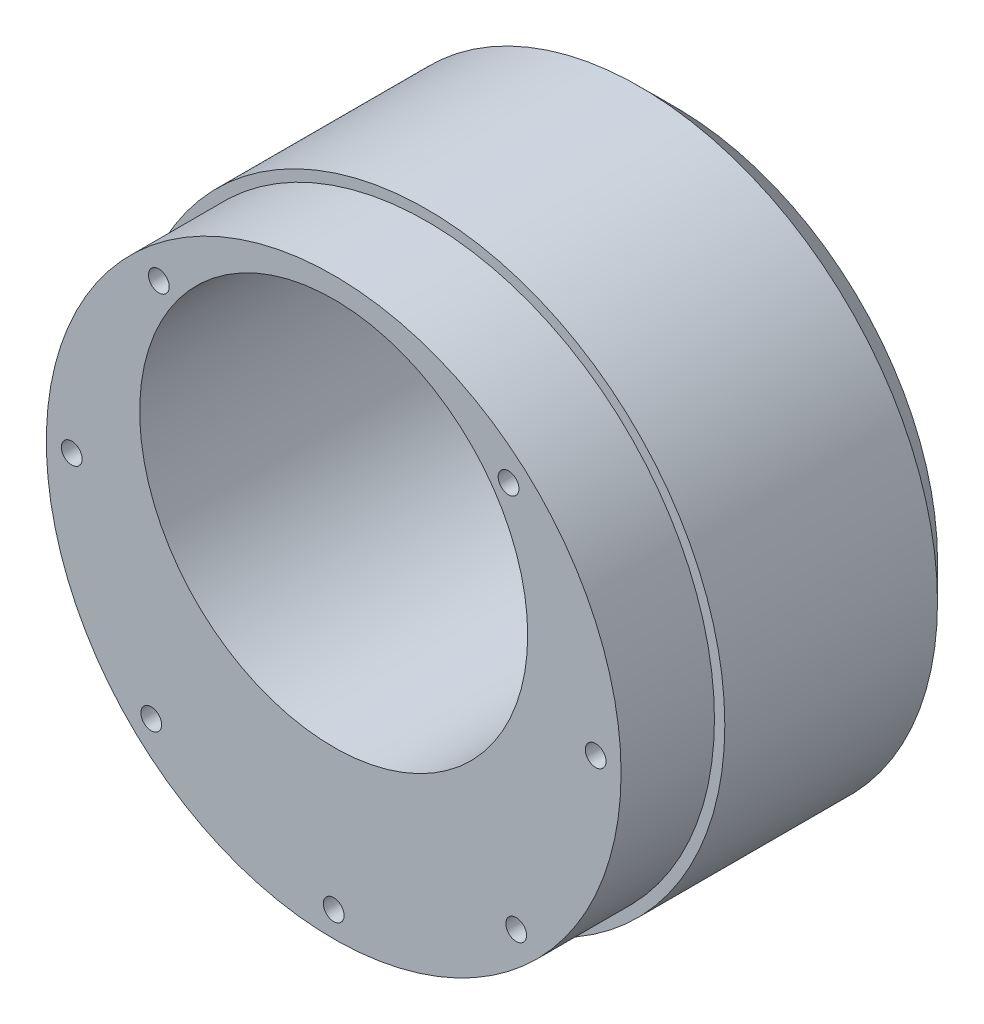
from build123d import *

# Parameters (mm, degrees)
SKETCH1_R              = 28.7
SKETCH1_R_2            = 6.15
SKETCH1_R_3            = 1.65
EXTRUDE_506_DEPTH      = 33
SKETCH2_R              = 18.7
CUT_EXTRUDE_685_DEPTH  = 27
CUT_EXTRUDE_START      = -9
SKETCH4_R              = 28.7
SKETCH4_R_2            = 27.7
CUT_EXTRUDE_817_DEPTH  = 9
SKETCH5_R              = 1
CUT_EXTRUDE_1184_DEPTH = 10
CHAMFER1_SIZE          = 3.5
SKETCH_1_R             = 3
CUT_EXTRUDE_1538_DEPTH = 2
CHAMFER_1590_SIZE      = 1.5


with BuildPart() as part:
    # Sketch1 → Extrude 506 (new body)
    with BuildSketch(Plane.XY):
        Circle(SKETCH1_R)
        Circle(SKETCH1_R_2, mode=Mode.SUBTRACT)
        with Locations((15.5, 7)):
            Circle(SKETCH1_R_3, mode=Mode.SUBTRACT)
        with Locations((7.75, -6.423393759)):
            Circle(SKETCH1_R_3, mode=Mode.SUBTRACT)
        with Locations((-7.75, -6.423393759)):
            Circle(SKETCH1_R_3, mode=Mode.SUBTRACT)
        with Locations((-15.5, 7)):
            Circle(SKETCH1_R_3, mode=Mode.SUBTRACT)
        with Locations((-7.75, 20.423393759)):
            Circle(SKETCH1_R_3, mode=Mode.SUBTRACT)
        with Locations((7.75, 20.423393759)):
            Circle(SKETCH1_R_3, mode=Mode.SUBTRACT)
    extrude(amount=EXTRUDE_506_DEPTH)

    # Sketch2 → Cut-Extrude 685 (cut)
    with BuildSketch(Plane.XY.offset(33)):
        with Locations((0, 7)):
            Circle(SKETCH2_R)
    extrude(amount=-CUT_EXTRUDE_685_DEPTH, mode=Mode.SUBTRACT)

    # Sketch4 → Cut-Extrude 817 (cut)
    with BuildSketch(Plane.XY.offset(33).offset(CUT_EXTRUDE_START)):
        Circle(SKETCH4_R)
        Circle(SKETCH4_R_2, mode=Mode.SUBTRACT)
    extrude(amount=CUT_EXTRUDE_817_DEPTH, mode=Mode.SUBTRACT)

    # Sketch5 → Cut-Extrude 1184 (cut)
    with BuildSketch(Plane.XY.offset(33)):
        with Locations((-25.248910365, 0.234574858)):
            Circle(SKETCH5_R)
        with Locations((-17.587461053, -18.117497446)):
            Circle(SKETCH5_R)
        with Locations(Location((17.587461053, -18.117497446, 0), (0, 0, 180))):
            Circle(SKETCH5_R)
        with Locations(Location((25.248910365, 0.234574858, 0), (0, 0, 180))):
            Circle(SKETCH5_R)
        with Locations((-16.85427288, 18.801488922)):
            Circle(SKETCH5_R)
        with Locations(Location((16.85427288, 18.801488922, 0), (0, 0, 180))):
            Circle(SKETCH5_R)
        with Locations((0, -25.25)):
            Circle(SKETCH5_R)
    extrude(amount=-CUT_EXTRUDE_1184_DEPTH, mode=Mode.SUBTRACT)

    # Chamfer1
    chamfer1_edges = [part.edges().sort_by_distance(p)[0] for p in [
        (-28.7, 0, 0),
    ]]
    chamfer(chamfer1_edges, length=CHAMFER1_SIZE)

    # Эскиз1 → Cut-Extrude 1538 (cut)
    with BuildSketch(Plane(origin=(0, 0, 0), x_dir=(-1, 0, 0), z_dir=(0, 0, -1))):
        with Locations((-7.75, 20.423393759)):
            Circle(SKETCH_1_R)
        with Locations((7.75, 20.423393759)):
            Circle(SKETCH_1_R)
        with Locations((15.5, 7)):
            Circle(SKETCH_1_R)
        with Locations((7.75, -6.423393759)):
            Circle(SKETCH_1_R)
        with Locations((-7.75, -6.423393759)):
            Circle(SKETCH_1_R)
        with Locations((-15.5, 7)):
            Circle(SKETCH_1_R)
    extrude(amount=-CUT_EXTRUDE_1538_DEPTH, mode=Mode.SUBTRACT)

    # Chamfer 1590
    # the kernel refuses this chamfer: 1.5 mm, written as the material it takes off along each edge
    with BuildSketch(Plane(origin=(15.5, 7, 2), x_dir=(1, 0, 0), z_dir=(0, 1, 0))) as chamfer_1590_piece_1_section:
        Polygon((1.65 + CHAMFER_1590_SIZE, 0), (1.65, -CHAMFER_1590_SIZE), (1.65, 0), align=None)
    chamfer_1590_piece_1 = revolve(axis=Axis((15.5, 7, 2), (0, 0, -1)), mode=Mode.PRIVATE)
    chamfer_1590_piece_1 = chamfer_1590_piece_1 & Plane(origin=(15.5, 7, 2.828305934), x_dir=(-1, 0, 0), z_dir=(0, 0, -1)) * Cylinder(3, 13, mode=Mode.PRIVATE)
    add(chamfer_1590_piece_1, mode=Mode.SUBTRACT)
    with BuildSketch(Plane(origin=(7.75, -6.423393759, 2), x_dir=(1, 0, 0), z_dir=(0, 1, 0))) as chamfer_1590_piece_2_section:
        Polygon((1.65 + CHAMFER_1590_SIZE, 0), (1.65, -CHAMFER_1590_SIZE), (1.65, 0), align=None)
    chamfer_1590_piece_2 = revolve(axis=Axis((7.75, -6.423393759, 2), (0, 0, -1)), mode=Mode.PRIVATE)
    chamfer_1590_piece_2 = chamfer_1590_piece_2 & Plane(origin=(7.75, -6.423393759, 2.828305934), x_dir=(-1, 0, 0), z_dir=(0, 0, -1)) * Cylinder(3, 13, mode=Mode.PRIVATE)
    add(chamfer_1590_piece_2, mode=Mode.SUBTRACT)
    with BuildSketch(Plane(origin=(-7.75, -6.423393759, 2), x_dir=(1, 0, 0), z_dir=(0, 1, 0))) as chamfer_1590_piece_3_section:
        Polygon((1.65 + CHAMFER_1590_SIZE, 0), (1.65, -CHAMFER_1590_SIZE), (1.65, 0), align=None)
    chamfer_1590_piece_3 = revolve(axis=Axis((-7.75, -6.423393759, 2), (0, 0, -1)), mode=Mode.PRIVATE)
    chamfer_1590_piece_3 = chamfer_1590_piece_3 & Plane(origin=(-7.75, -6.423393759, 2.828305934), x_dir=(-1, 0, 0), z_dir=(0, 0, -1)) * Cylinder(3, 13, mode=Mode.PRIVATE)
    add(chamfer_1590_piece_3, mode=Mode.SUBTRACT)
    with BuildSketch(Plane(origin=(-15.5, 7, 2), x_dir=(1, 0, 0), z_dir=(0, 1, 0))) as chamfer_1590_piece_4_section:
        Polygon((1.65 + CHAMFER_1590_SIZE, 0), (1.65, -CHAMFER_1590_SIZE), (1.65, 0), align=None)
    chamfer_1590_piece_4 = revolve(axis=Axis((-15.5, 7, 2), (0, 0, -1)), mode=Mode.PRIVATE)
    chamfer_1590_piece_4 = chamfer_1590_piece_4 & Plane(origin=(-15.5, 7, 2.828305934), x_dir=(-1, 0, 0), z_dir=(0, 0, -1)) * Cylinder(3, 13, mode=Mode.PRIVATE)
    add(chamfer_1590_piece_4, mode=Mode.SUBTRACT)
    with BuildSketch(Plane(origin=(-7.75, 20.423393759, 2), x_dir=(1, 0, 0), z_dir=(0, 1, 0))) as chamfer_1590_piece_5_section:
        Polygon((1.65 + CHAMFER_1590_SIZE, 0), (1.65, -CHAMFER_1590_SIZE), (1.65, 0), align=None)
    chamfer_1590_piece_5 = revolve(axis=Axis((-7.75, 20.423393759, 2), (0, 0, -1)), mode=Mode.PRIVATE)
    chamfer_1590_piece_5 = chamfer_1590_piece_5 & Plane(origin=(-7.75, 20.423393759, 2.828305934), x_dir=(-1, 0, 0), z_dir=(0, 0, -1)) * Cylinder(3, 13, mode=Mode.PRIVATE)
    add(chamfer_1590_piece_5, mode=Mode.SUBTRACT)
    with BuildSketch(Plane(origin=(7.75, 20.423393759, 2), x_dir=(1, 0, 0), z_dir=(0, 1, 0))) as chamfer_1590_piece_6_section:
        Polygon((1.65 + CHAMFER_1590_SIZE, 0), (1.65, -CHAMFER_1590_SIZE), (1.65, 0), align=None)
    chamfer_1590_piece_6 = revolve(axis=Axis((7.75, 20.423393759, 2), (0, 0, -1)), mode=Mode.PRIVATE)
    chamfer_1590_piece_6 = chamfer_1590_piece_6 & Plane(origin=(7.75, 20.423393759, 2.828305934), x_dir=(-1, 0, 0), z_dir=(0, 0, -1)) * Cylinder(3, 13, mode=Mode.PRIVATE)
    add(chamfer_1590_piece_6, mode=Mode.SUBTRACT)


solid = part.part
